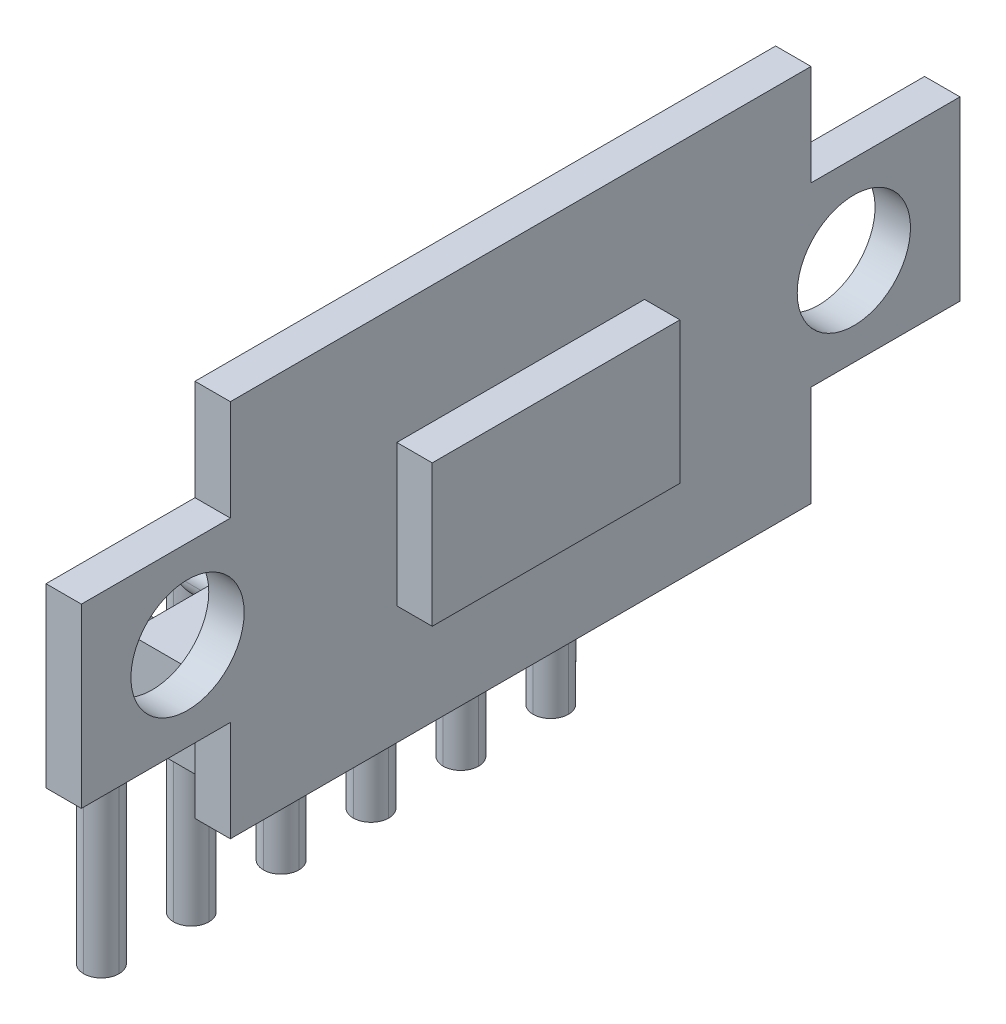
from build123d import *

# Parameters (mm, degrees)
SKETCH1_R              = 1.6
BOSS_EXTRUDE1_DEPTH    = 1
SKETCH2_W              = 7
SKETCH2_H              = 4
BOSS_EXTRUDE2_DEPTH    = 1
SKETCH4_W              = 15.24
SKETCH4_H              = 2.5
BOSS_EXTRUDE3_DEPTH    = 2.5
SKETCH6_W              = 1
SKETCH6_H              = 1
BOSS_EXTRUDE4_DEPTH    = 2.5
SKETCH8_W              = 1
SKETCH8_H              = 1
BOSS_EXTRUDE5_DEPTH    = 8
FILLET1_R              = 0.5
LPATTERN1_COUNT        = 6
LPATTERN1_PITCH        = 2.54
FILLET1_OF_LPATTERN1_R = 0.5


with BuildPart() as part:
    # Sketch1 → Boss-Extrude1 (new body)
    with BuildSketch(Plane(origin=(0, 0, 0), x_dir=(0, 0, -1), z_dir=(1, 0, 0))):
        Polygon((-8.205, 2.5), (-12.415, 2.5), (-12.415, -2.5), (-8.205, -2.5), (-8.205, -5.35), (8.205, -5.35), (8.205, -2.5), (12.415, -2.5), (12.415, 2.5), (8.205, 2.5), (8.205, 5.35), (-8.205, 5.35), align=None)
        with Locations((-9.415, 0)):
            Circle(SKETCH1_R, mode=Mode.SUBTRACT)
        with Locations(Location((9.415, 0, 0), (0, 0, 180))):
            Circle(SKETCH1_R, mode=Mode.SUBTRACT)
    extrude(amount=BOSS_EXTRUDE1_DEPTH)

    # Sketch2 → Boss-Extrude2 (add)
    with BuildSketch(Plane(origin=(1, 0, 0), x_dir=(0, 0, -1), z_dir=(1, 0, 0))):
        Rectangle(SKETCH2_W, SKETCH2_H)
    extrude(amount=BOSS_EXTRUDE2_DEPTH)

    # Sketch4 → Boss-Extrude3 (add)
    with BuildSketch(Plane(origin=(0, 6.053191046, 0.231711856), x_dir=(0, 0, 1), z_dir=(-1, 0, 0))):
        with Locations((-0.231711856, -9.653191046)):
            Rectangle(SKETCH4_W, SKETCH4_H)
    extrude(amount=BOSS_EXTRUDE3_DEPTH)

    # Sketch6 → Boss-Extrude4 (add)
    with BuildSketch(Plane(origin=(-2.5, 6.053191046, 0.231711856), x_dir=(0, 0, 1), z_dir=(-1, 0, 0))):
        with Locations((-6.581711856, -9.633191046)):
            Rectangle(SKETCH6_W, SKETCH6_H)
    boss_extrude4 = extrude(amount=BOSS_EXTRUDE4_DEPTH)

    # Sketch8 → Boss-Extrude5 (add)
    with BuildSketch(Plane(origin=(1, -4.08, 0.231711856), x_dir=(0, 0, 1), z_dir=(0, -1, 0))):
        with Locations((-6.581711856, 5.5)):
            Rectangle(SKETCH8_W, SKETCH8_H)
    boss_extrude5 = extrude(amount=BOSS_EXTRUDE5_DEPTH)

    # Fillet1
    fillet1_edges = [part.edges().sort_by_distance(p)[0] for p in [
        (-4, -8.08, -5.85),
        (-4, -8.08, -6.85),
        (-3.25, -4.08, -5.85),
        (-3.25, -4.08, -6.85),
        (-3.75, -3.08, -5.85),
        (-3.75, -3.08, -6.85),
        (-5, -7.58, -5.85),
        (-5, -7.58, -6.85),
    ]]
    fillet(fillet1_edges, radius=FILLET1_R - 0.0001)  # a hair under: the kernel refuses the full size

    # LPattern1: Boss-Extrude4, Boss-Extrude5 ×6
    with Locations(*[(0, 0, i * LPATTERN1_PITCH) for i in range(1, LPATTERN1_COUNT)]):
        add(boss_extrude4)
        add(boss_extrude5)

    # Fillet1 of LPattern1
    fillet1_of_lpattern1_edges = [part.edges().sort_by_distance(p)[0] for p in [
        (-4, -8.08, -3.31),
        (-4, -8.08, -4.31),
        (-3.25, -4.08, -3.31),
        (-3.25, -4.08, -4.31),
        (-3.75, -3.08, -3.31),
        (-3.75, -3.08, -4.31),
        (-5, -7.58, -3.31),
        (-5, -7.58, -4.31),
        (-4, -8.08, -0.77),
        (-4, -8.08, -1.77),
        (-3.25, -4.08, -0.77),
        (-3.25, -4.08, -1.77),
        (-3.75, -3.08, -0.77),
        (-3.75, -3.08, -1.77),
        (-5, -7.58, -0.77),
        (-5, -7.58, -1.77),
        (-4, -8.08, 1.77),
        (-4, -8.08, 0.77),
        (-3.25, -4.08, 1.77),
        (-3.25, -4.08, 0.77),
        (-3.75, -3.08, 1.77),
        (-3.75, -3.08, 0.77),
        (-5, -7.58, 1.77),
        (-5, -7.58, 0.77),
        (-4, -8.08, 4.31),
        (-4, -8.08, 3.31),
        (-3.25, -4.08, 4.31),
        (-3.25, -4.08, 3.31),
        (-3.75, -3.08, 4.31),
        (-3.75, -3.08, 3.31),
        (-5, -7.58, 4.31),
        (-5, -7.58, 3.31),
        (-4, -8.08, 6.85),
        (-4, -8.08, 5.85),
        (-3.25, -4.08, 6.85),
        (-3.25, -4.08, 5.85),
        (-3.75, -3.08, 6.85),
        (-3.75, -3.08, 5.85),
        (-5, -7.58, 6.85),
        (-5, -7.58, 5.85),
    ]]
    fillet(fillet1_of_lpattern1_edges, radius=FILLET1_OF_LPATTERN1_R - 0.0001)  # a hair under: the kernel refuses the full size


solid = part.part
